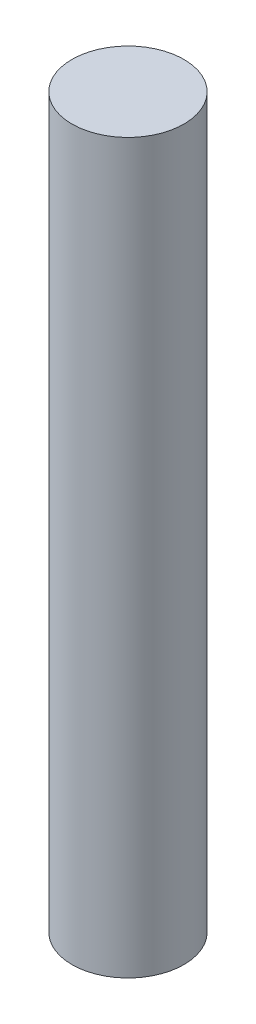
from build123d import *

# Parameters (mm, degrees)
SKETCH1_R           = 3.175
BOSS_EXTRUDE1_DEPTH = 41.275


with BuildPart() as part:
    # Sketch1 → Boss-Extrude1 (new body)
    with BuildSketch(Plane(origin=(0, 0, 0), x_dir=(1, 0, 0), z_dir=(0, 1, 0))):
        Circle(SKETCH1_R)
    extrude(amount=BOSS_EXTRUDE1_DEPTH)


solid = part.part
